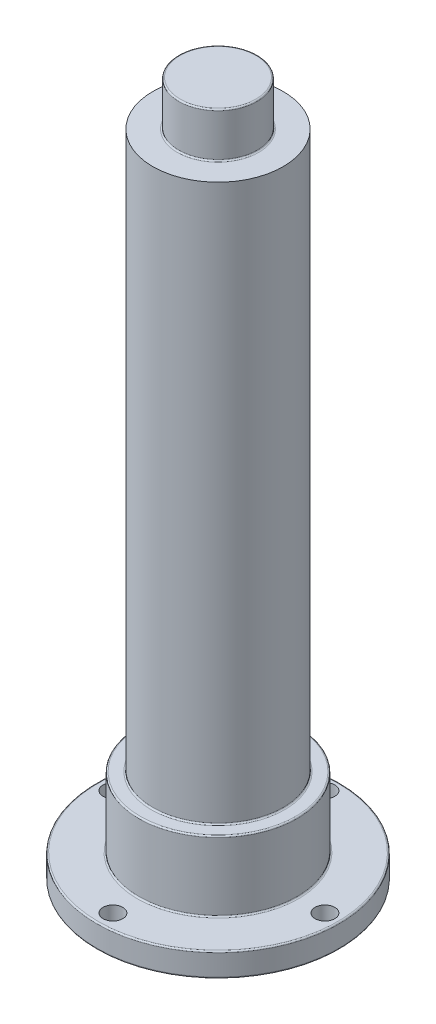
from build123d import *

# Parameters (mm, degrees)
SKETCH2_R               = 21.971
BOSS_EXTRUDE1_DEPTH     = 2.159
SKETCH3_R               = 14.351
BOSS_EXTRUDE2_DEPTH     = 12.7
SKETCH4_R               = 11.811
BOSS_EXTRUDE3_DEPTH     = 100.838
SKETCH5_R               = 7.112
BOSS_EXTRUDE4_DEPTH     = 8.128
FILLET1_R               = 0.254
SKETCH6_R               = 1.7907
CUT_EXTRUDE2_DEPTH      = 130.759076532
SKETCH6_4_R             = 1.651
CUT_EXTRUDE3_DEPTH      = 17.78
CIRPATTERN2_START       = -2.159
CIRPATTERN2_OUTLINE_R   = 1.7907
CIRPATTERN2_OUTLINE_R_2 = 1.651
CIRPATTERN2_DEPTH       = 17.78
SKETCH8_R               = 1.7907
CUT_EXTRUDE4_DEPTH      = 17.78


# Read off the part's stored shape, not the designer's step: CirPattern2
with BuildPart() as part:
    # Sketch2 → Boss-Extrude1 (new, symmetric)
    with BuildSketch(Plane(origin=(0, 0, 0), x_dir=(1, 0, 0), z_dir=(0, 1, 0))):
        with Locations(Location((0, 0, 0), (0, 0, 270))):
            Circle(SKETCH2_R)
    extrude(amount=BOSS_EXTRUDE1_DEPTH, both=True)

    # Sketch3 → Boss-Extrude2 (add)
    with BuildSketch(Plane(origin=(0, 2.159, 0), x_dir=(1, 0, 0), z_dir=(0, 1, 0))):
        with Locations(Location((0, 0, 0), (0, 0, 270))):
            Circle(SKETCH3_R)
    extrude(amount=BOSS_EXTRUDE2_DEPTH)

    # Sketch4 → Boss-Extrude3 (add)
    with BuildSketch(Plane(origin=(0, 14.859, 0), x_dir=(1, 0, 0), z_dir=(0, 1, 0))):
        with Locations(Location((0, 0, 0), (0, 0, 270))):
            Circle(SKETCH4_R)
    extrude(amount=BOSS_EXTRUDE3_DEPTH)

    # Sketch5 → Boss-Extrude4 (add)
    with BuildSketch(Plane(origin=(0, 115.697, 0), x_dir=(1, 0, 0), z_dir=(0, 1, 0))):
        with Locations(Location((0, 0, 0), (0, 0, 270))):
            Circle(SKETCH5_R)
    extrude(amount=BOSS_EXTRUDE4_DEPTH)

    # Fillet1
    fillet1_edges = [part.edges().sort_by_distance(p)[0] for p in [
        (0, 14.859, -11.811),
        (0, 115.697, -7.112),
        (0, 123.825, -7.112),
        (0, -2.159, -21.971),
        (0, 2.159, -21.971),
        (0, 2.159, -14.351),
        (0, 14.859, -14.351),
    ]]
    fillet(fillet1_edges, radius=FILLET1_R)

    # Sketch6 → Cut-Extrude2 (cut, through all)
    with BuildSketch(Plane.XZ.offset(2.159)):
        with Locations(Location((0, 19.05, 0), (0, 0, 270))):
            Circle(SKETCH6_R)
    extrude(amount=-CUT_EXTRUDE2_DEPTH, mode=Mode.SUBTRACT)

    # Sketch6<4> → Cut-Extrude3 (cut)
    with BuildSketch(Plane.XZ.offset(2.159)):
        with Locations(Location((0, 6.096, 0), (0, 0, 270))):
            Circle(SKETCH6_4_R)
    extrude(amount=-CUT_EXTRUDE3_DEPTH, mode=Mode.SUBTRACT)

    # CirPattern2 outline → CirPattern2 (cut)
    with BuildSketch(Plane(origin=(0, 0, 0), x_dir=(1, 0, 0), z_dir=(0, 1, 0)).offset(CIRPATTERN2_START)):
        with Locations((19.216852173, 0.166852173)):
            Circle(CIRPATTERN2_OUTLINE_R)
        with Locations((0, 19.383704346)):
            Circle(CIRPATTERN2_OUTLINE_R)
        with Locations((-19.216852173, 0.166852173)):
            Circle(CIRPATTERN2_OUTLINE_R)
        with Locations((6.127741136, 0.031741136)):
            Circle(CIRPATTERN2_OUTLINE_R_2)
        with Locations((0, 6.159482272)):
            Circle(CIRPATTERN2_OUTLINE_R_2)
        with Locations((-6.127741136, 0.031741136)):
            Circle(CIRPATTERN2_OUTLINE_R_2)
    extrude(amount=CIRPATTERN2_DEPTH, mode=Mode.SUBTRACT)

    # Sketch8 → Cut-Extrude4 (cut)
    with BuildSketch(Plane.XZ.offset(2.159)):
        with Locations(Location((0, 0, 0), (0, 0, 270))):
            Circle(SKETCH8_R)
    extrude(amount=-CUT_EXTRUDE4_DEPTH, mode=Mode.SUBTRACT)


solid = part.part
